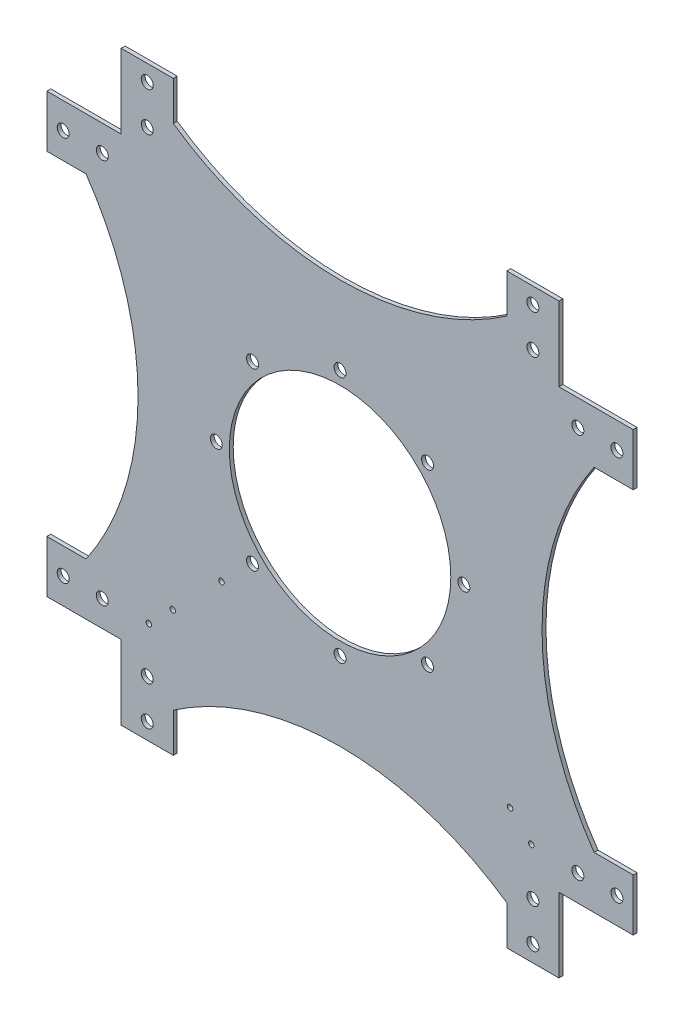
from build123d import *

# Parameters (mm, degrees)
SKETCH1_R          = 85
BASE_FLANGE1_DEPTH = 3
SKETCH2_R          = 4.6
EXTRUDE1_DEPTH     = 3
SKETCH3_R          = 4.6
EXTRUDE2_DEPTH     = 3
CIRPATTERN1_COUNT  = 8
SKETCH4_R          = 2.1
CUT_EXTRUDE1_DEPTH = 10


# Sheet-metal steps are written as plain solids
with BuildPart() as part:
    # Sketch1 → Base-Flange1 (new body)
    with BuildSketch(Plane.XY):
        with BuildLine():
            Line((168, 168), (168, 225))
            Line((168, 225), (128, 225))
            Line((128, 225), (128, 195))
            ThreePointArc((128, 195), (0, 155.04323819), (-128, 195))
            Line((-128, 195), (-128, 225))
            Line((-128, 225), (-168, 225))
            Line((-168, 225), (-168, 168))
            Line((-168, 168), (-225, 168))
            Line((-225, 168), (-225, 128))
            Line((-225, 128), (-195, 128))
            ThreePointArc((-195, 128), (-155.04323819, 0), (-195, -128))
            Line((-195, -128), (-225, -128))
            Line((-225, -128), (-225, -168))
            Line((-225, -168), (-168, -168))
            Line((-168, -168), (-168, -225))
            Line((-168, -225), (-128, -225))
            Line((-128, -225), (-128, -195))
            ThreePointArc((-128, -195), (0, -155.04323819), (128, -195))
            Line((128, -195), (128, -225))
            Line((128, -225), (168, -225))
            Line((168, -225), (168, -168))
            Line((168, -168), (225, -168))
            Line((225, -168), (225, -128))
            Line((225, -128), (195, -128))
            ThreePointArc((195, -128), (155.04323819, 0), (195, 128))
            Line((195, 128), (225, 128))
            Line((225, 128), (225, 168))
            Line((225, 168), (168, 168))
        make_face()
        Circle(SKETCH1_R, mode=Mode.SUBTRACT)
    extrude(amount=BASE_FLANGE1_DEPTH)

    # Sketch2 → Extrude1 (cut)
    with BuildSketch(Plane.XY.offset(3)):
        with Locations((148, 212.5)):
            Circle(SKETCH2_R)
        with Locations((148, 182.5)):
            Circle(SKETCH2_R)
        with Locations((182.5, 148)):
            Circle(SKETCH2_R)
        with Locations((212.5, 148)):
            Circle(SKETCH2_R)
        with Locations(Location((212.5, -148, 0), (0, 0, 180))):
            Circle(SKETCH2_R)
        with Locations(Location((182.5, -148, 0), (0, 0, 180))):
            Circle(SKETCH2_R)
        with Locations(Location((148, -182.5, 0), (0, 0, 180))):
            Circle(SKETCH2_R)
        with Locations(Location((148, -212.5, 0), (0, 0, 180))):
            Circle(SKETCH2_R)
        with Locations((-148, -212.5)):
            Circle(SKETCH2_R)
        with Locations((-148, -182.5)):
            Circle(SKETCH2_R)
        with Locations((-182.5, -148)):
            Circle(SKETCH2_R)
        with Locations((-212.5, -148)):
            Circle(SKETCH2_R)
        with Locations(Location((-212.5, 148, 0), (0, 0, 180))):
            Circle(SKETCH2_R)
        with Locations(Location((-182.5, 148, 0), (0, 0, 180))):
            Circle(SKETCH2_R)
        with Locations(Location((-148, 182.5, 0), (0, 0, 180))):
            Circle(SKETCH2_R)
        with Locations(Location((-148, 212.5, 0), (0, 0, 180))):
            Circle(SKETCH2_R)
    extrude(amount=-EXTRUDE1_DEPTH, mode=Mode.SUBTRACT)

    # Sketch3 → Extrude2 (cut)
    with BuildSketch(Plane.XY.offset(3)):
        with Locations((0, 95)):
            Circle(SKETCH3_R)
    extrude2 = extrude(amount=-EXTRUDE2_DEPTH, mode=Mode.SUBTRACT)

    # CirPattern1: Extrude2 ×8 about axis
    cirpattern1_axis = Axis((0, 0, 0), (0, 0, 1))
    for i in range(1, CIRPATTERN1_COUNT):
        add(extrude2.rotate(cirpattern1_axis, i * 360 / CIRPATTERN1_COUNT), mode=Mode.SUBTRACT)

    # Sketch4 → Cut-Extrude1 (cut)
    with BuildSketch(Plane.XY.offset(3)):
        with Locations((-146.786796564, -146.786796564)):
            Circle(SKETCH4_R)
        with Locations((-128.402020254, -128.402020254)):
            Circle(SKETCH4_R)
        with Locations((-90.925360851, -90.925360851)):
            Circle(SKETCH4_R)
        with Locations((130.523340597, -130.523340597)):
            Circle(SKETCH4_R)
        with Locations((146.786796564, -146.786796564)):
            Circle(SKETCH4_R)
    extrude(amount=-CUT_EXTRUDE1_DEPTH, mode=Mode.SUBTRACT)


solid = part.part
